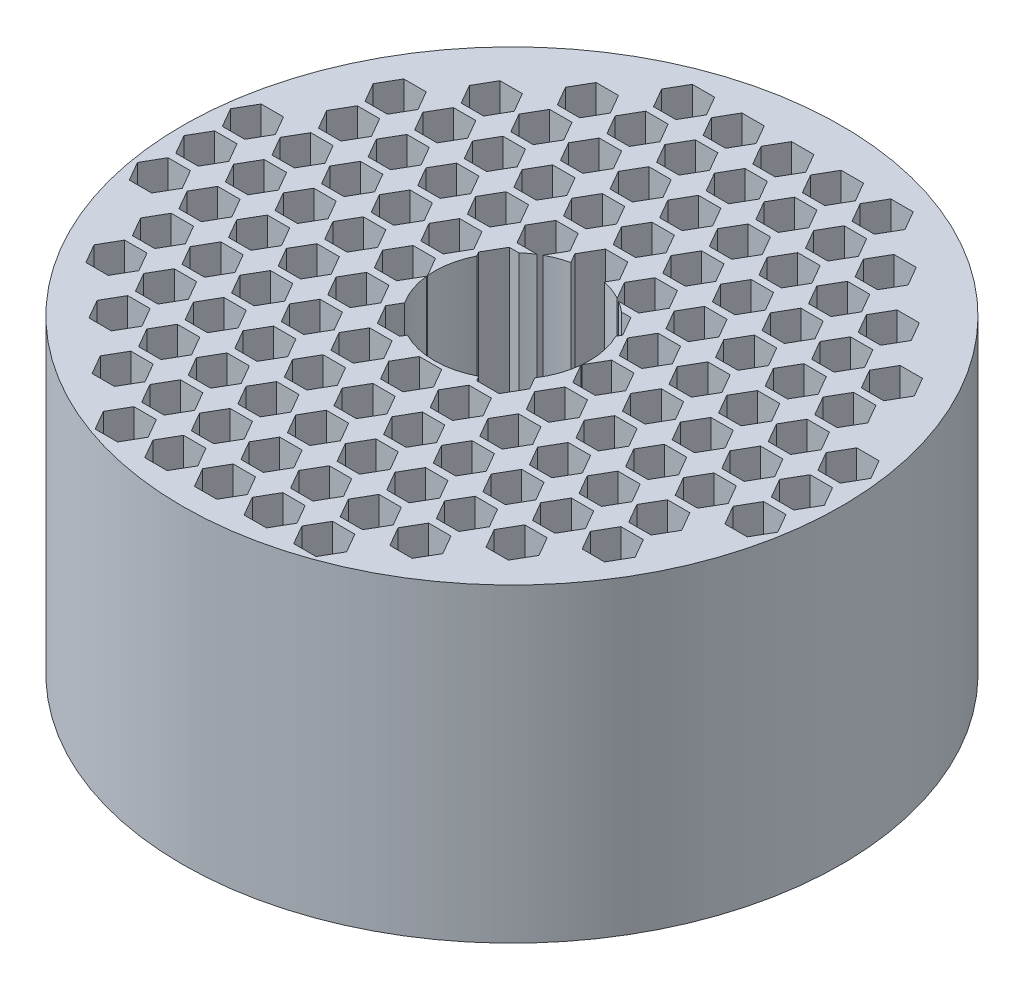
from build123d import *

# Parameters (mm, degrees)
SKETCH1_R            = 26.9875
BOSS_EXTRUDE1_DEPTH  = 25.4
CUT_EXTRUDE1_REACH   = 47.846
LPATTERN2_COUNT      = 13
LPATTERN2_PITCH      = 3.81
LPATTERN2_COUNT_DIR2 = 10
LPATTERN2_PITCH_DIR2 = 4.064
MIRROR1_DEPTH        = 25.4
CUT_EXTRUDE2_REACH   = 47.846
SKETCH5_R            = 6.35


# Read off the part's stored shape, not the designer's step: Mirror1
with BuildPart() as part:
    # Sketch1 → Boss-Extrude1 (new body)
    with BuildSketch(Plane(origin=(0, 0, 0), x_dir=(1, 0, 0), z_dir=(0, 1, 0))):
        with Locations(Location((0, 0, 0), (0, 0, 270))):
            Circle(SKETCH1_R)
    extrude(amount=BOSS_EXTRUDE1_DEPTH)

    # Sketch2 → Cut-Extrude1 (cut, up to next)
    with BuildSketch(Plane(origin=(0, 25.4, 0), x_dir=(1, 0, 0), z_dir=(0, 1, 0)), mode=Mode.PRIVATE) as cut_extrude1_sk1:
        Polygon((0.916543552, 20.6375), (1.833087105, 22.225), (0.916543552, 23.8125), (-0.916543552, 23.8125), (-1.833087105, 22.225), (-0.916543552, 20.6375), align=None)
    cut_extrude1_tool1 = extrude(cut_extrude1_sk1.sketch, amount=-CUT_EXTRUDE1_REACH, mode=Mode.PRIVATE) & part.part
    cut_extrude1 = cut_extrude1_tool1.solids().sort_by_distance((0, 25.4, -22.225))[0]
    add(cut_extrude1, mode=Mode.SUBTRACT)

    # LPattern2: Cut-Extrude1 13 × 10, 61 skipped
    with Locations(*[(-j * LPATTERN2_PITCH_DIR2, 0, i * LPATTERN2_PITCH) for i in range(LPATTERN2_COUNT) for j in range(LPATTERN2_COUNT_DIR2) if (i, j) not in ((0, 0), (0, 3), (0, 4), (0, 5), (0, 6), (0, 7), (0, 8), (0, 9), (1, 4), (1, 5), (1, 6), (1, 7), (1, 8), (1, 9), (2, 5), (2, 6), (2, 7), (2, 8), (2, 9), (3, 6), (3, 7), (3, 8), (3, 9), (4, 6), (4, 7), (4, 8), (4, 9), (5, 7), (5, 8), (5, 9), (6, 7), (6, 8), (6, 9), (7, 7), (7, 8), (7, 9), (8, 6), (8, 7), (8, 8), (8, 9), (9, 6), (9, 7), (9, 8), (9, 9), (10, 5), (10, 6), (10, 7), (10, 8), (10, 9), (11, 4), (11, 5), (11, 6), (11, 7), (11, 8), (11, 9), (12, 3), (12, 4), (12, 5), (12, 6), (12, 7), (12, 8), (12, 9))]):
        add(cut_extrude1, mode=Mode.SUBTRACT)

    # Mirror1 outline → Mirror1 (cut)
    with BuildSketch(Plane(origin=(0, 0, 0), x_dir=(1, 0, 0), z_dir=(0, 1, 0))):
        Polygon((3.147456448, 20.6375), (4.980543552, 20.6375), (5.897087105, 22.225), (4.980543552, 23.8125), (3.147456448, 23.8125), (2.230912895, 22.225), align=None)
        Polygon((7.211456448, 20.6375), (9.044543552, 20.6375), (9.961087105, 22.225), (9.044543552, 23.8125), (7.211456448, 23.8125), (6.294912895, 22.225), align=None)
        Polygon((3.147456448, 16.8275), (4.980543552, 16.8275), (5.897087105, 18.415), (4.980543552, 20.0025), (3.147456448, 20.0025), (2.230912895, 18.415), align=None)
        Polygon((7.211456448, 16.8275), (9.044543552, 16.8275), (9.961087105, 18.415), (9.044543552, 20.0025), (7.211456448, 20.0025), (6.294912895, 18.415), align=None)
        Polygon((11.275456448, 16.8275), (13.108543552, 16.8275), (14.025087105, 18.415), (13.108543552, 20.0025), (11.275456448, 20.0025), (10.358912895, 18.415), align=None)
        Polygon((3.147456448, 13.0175), (4.980543552, 13.0175), (5.897087105, 14.605), (4.980543552, 16.1925), (3.147456448, 16.1925), (2.230912895, 14.605), align=None)
        Polygon((7.211456448, 13.0175), (9.044543552, 13.0175), (9.961087105, 14.605), (9.044543552, 16.1925), (7.211456448, 16.1925), (6.294912895, 14.605), align=None)
        Polygon((11.275456448, 13.0175), (13.108543552, 13.0175), (14.025087105, 14.605), (13.108543552, 16.1925), (11.275456448, 16.1925), (10.358912895, 14.605), align=None)
        Polygon((15.339456448, 13.0175), (17.172543552, 13.0175), (18.089087105, 14.605), (17.172543552, 16.1925), (15.339456448, 16.1925), (14.422912895, 14.605), align=None)
        Polygon((3.147456448, 9.2075), (4.980543552, 9.2075), (5.897087105, 10.795), (4.980543552, 12.3825), (3.147456448, 12.3825), (2.230912895, 10.795), align=None)
        Polygon((7.211456448, 9.2075), (9.044543552, 9.2075), (9.961087105, 10.795), (9.044543552, 12.3825), (7.211456448, 12.3825), (6.294912895, 10.795), align=None)
        Polygon((11.275456448, 9.2075), (13.108543552, 9.2075), (14.025087105, 10.795), (13.108543552, 12.3825), (11.275456448, 12.3825), (10.358912895, 10.795), align=None)
        Polygon((15.339456448, 9.2075), (17.172543552, 9.2075), (18.089087105, 10.795), (17.172543552, 12.3825), (15.339456448, 12.3825), (14.422912895, 10.795), align=None)
        Polygon((19.403456448, 9.2075), (21.236543552, 9.2075), (22.153087105, 10.795), (21.236543552, 12.3825), (19.403456448, 12.3825), (18.486912895, 10.795), align=None)
        Polygon((3.147456448, 5.3975), (4.980543552, 5.3975), (5.897087105, 6.985), (4.980543552, 8.5725), (3.147456448, 8.5725), (2.230912895, 6.985), align=None)
        Polygon((7.211456448, 5.3975), (9.044543552, 5.3975), (9.961087105, 6.985), (9.044543552, 8.5725), (7.211456448, 8.5725), (6.294912895, 6.985), align=None)
        Polygon((11.275456448, 5.3975), (13.108543552, 5.3975), (14.025087105, 6.985), (13.108543552, 8.5725), (11.275456448, 8.5725), (10.358912895, 6.985), align=None)
        Polygon((15.339456448, 5.3975), (17.172543552, 5.3975), (18.089087105, 6.985), (17.172543552, 8.5725), (15.339456448, 8.5725), (14.422912895, 6.985), align=None)
        Polygon((19.403456448, 5.3975), (21.236543552, 5.3975), (22.153087105, 6.985), (21.236543552, 8.5725), (19.403456448, 8.5725), (18.486912895, 6.985), align=None)
        Polygon((3.147456448, 1.5875), (4.980543552, 1.5875), (5.897087105, 3.175), (4.980543552, 4.7625), (3.147456448, 4.7625), (2.230912895, 3.175), align=None)
        Polygon((7.211456448, 1.5875), (9.044543552, 1.5875), (9.961087105, 3.175), (9.044543552, 4.7625), (7.211456448, 4.7625), (6.294912895, 3.175), align=None)
        Polygon((11.275456448, 1.5875), (13.108543552, 1.5875), (14.025087105, 3.175), (13.108543552, 4.7625), (11.275456448, 4.7625), (10.358912895, 3.175), align=None)
        Polygon((15.339456448, 1.5875), (17.172543552, 1.5875), (18.089087105, 3.175), (17.172543552, 4.7625), (15.339456448, 4.7625), (14.422912895, 3.175), align=None)
        Polygon((19.403456448, 1.5875), (21.236543552, 1.5875), (22.153087105, 3.175), (21.236543552, 4.7625), (19.403456448, 4.7625), (18.486912895, 3.175), align=None)
        Polygon((23.467456448, 1.5875), (25.300543552, 1.5875), (26.217087105, 3.175), (25.300543552, 4.7625), (23.467456448, 4.7625), (22.550912895, 3.175), align=None)
        Polygon((3.147456448, -2.2225), (4.980543552, -2.2225), (5.897087105, -0.635), (4.980543552, 0.9525), (3.147456448, 0.9525), (2.230912895, -0.635), align=None)
        Polygon((7.211456448, -2.2225), (9.044543552, -2.2225), (9.961087105, -0.635), (9.044543552, 0.9525), (7.211456448, 0.9525), (6.294912895, -0.635), align=None)
        Polygon((11.275456448, -2.2225), (13.108543552, -2.2225), (14.025087105, -0.635), (13.108543552, 0.9525), (11.275456448, 0.9525), (10.358912895, -0.635), align=None)
        Polygon((15.339456448, -2.2225), (17.172543552, -2.2225), (18.089087105, -0.635), (17.172543552, 0.9525), (15.339456448, 0.9525), (14.422912895, -0.635), align=None)
        Polygon((19.403456448, -2.2225), (21.236543552, -2.2225), (22.153087105, -0.635), (21.236543552, 0.9525), (19.403456448, 0.9525), (18.486912895, -0.635), align=None)
        Polygon((23.467456448, -2.2225), (25.300543552, -2.2225), (26.217087105, -0.635), (25.300543552, 0.9525), (23.467456448, 0.9525), (22.550912895, -0.635), align=None)
        Polygon((3.147456448, -6.0325), (4.980543552, -6.0325), (5.897087105, -4.445), (4.980543552, -2.8575), (3.147456448, -2.8575), (2.230912895, -4.445), align=None)
        Polygon((7.211456448, -6.0325), (9.044543552, -6.0325), (9.961087105, -4.445), (9.044543552, -2.8575), (7.211456448, -2.8575), (6.294912895, -4.445), align=None)
        Polygon((11.275456448, -6.0325), (13.108543552, -6.0325), (14.025087105, -4.445), (13.108543552, -2.8575), (11.275456448, -2.8575), (10.358912895, -4.445), align=None)
        Polygon((15.339456448, -6.0325), (17.172543552, -6.0325), (18.089087105, -4.445), (17.172543552, -2.8575), (15.339456448, -2.8575), (14.422912895, -4.445), align=None)
        Polygon((19.403456448, -6.0325), (21.236543552, -6.0325), (22.153087105, -4.445), (21.236543552, -2.8575), (19.403456448, -2.8575), (18.486912895, -4.445), align=None)
        Polygon((23.467456448, -6.0325), (25.300543552, -6.0325), (26.217087105, -4.445), (25.300543552, -2.8575), (23.467456448, -2.8575), (22.550912895, -4.445), align=None)
        Polygon((3.147456448, -9.8425), (4.980543552, -9.8425), (5.897087105, -8.255), (4.980543552, -6.6675), (3.147456448, -6.6675), (2.230912895, -8.255), align=None)
        Polygon((7.211456448, -9.8425), (9.044543552, -9.8425), (9.961087105, -8.255), (9.044543552, -6.6675), (7.211456448, -6.6675), (6.294912895, -8.255), align=None)
        Polygon((11.275456448, -9.8425), (13.108543552, -9.8425), (14.025087105, -8.255), (13.108543552, -6.6675), (11.275456448, -6.6675), (10.358912895, -8.255), align=None)
        Polygon((15.339456448, -9.8425), (17.172543552, -9.8425), (18.089087105, -8.255), (17.172543552, -6.6675), (15.339456448, -6.6675), (14.422912895, -8.255), align=None)
        Polygon((19.403456448, -9.8425), (21.236543552, -9.8425), (22.153087105, -8.255), (21.236543552, -6.6675), (19.403456448, -6.6675), (18.486912895, -8.255), align=None)
        Polygon((3.147456448, -13.6525), (4.980543552, -13.6525), (5.897087105, -12.065), (4.980543552, -10.4775), (3.147456448, -10.4775), (2.230912895, -12.065), align=None)
        Polygon((7.211456448, -13.6525), (9.044543552, -13.6525), (9.961087105, -12.065), (9.044543552, -10.4775), (7.211456448, -10.4775), (6.294912895, -12.065), align=None)
        Polygon((11.275456448, -13.6525), (13.108543552, -13.6525), (14.025087105, -12.065), (13.108543552, -10.4775), (11.275456448, -10.4775), (10.358912895, -12.065), align=None)
        Polygon((15.339456448, -13.6525), (17.172543552, -13.6525), (18.089087105, -12.065), (17.172543552, -10.4775), (15.339456448, -10.4775), (14.422912895, -12.065), align=None)
        Polygon((19.403456448, -13.6525), (21.236543552, -13.6525), (22.153087105, -12.065), (21.236543552, -10.4775), (19.403456448, -10.4775), (18.486912895, -12.065), align=None)
        Polygon((3.147456448, -17.4625), (4.980543552, -17.4625), (5.897087105, -15.875), (4.980543552, -14.2875), (3.147456448, -14.2875), (2.230912895, -15.875), align=None)
        Polygon((7.211456448, -17.4625), (9.044543552, -17.4625), (9.961087105, -15.875), (9.044543552, -14.2875), (7.211456448, -14.2875), (6.294912895, -15.875), align=None)
        Polygon((11.275456448, -17.4625), (13.108543552, -17.4625), (14.025087105, -15.875), (13.108543552, -14.2875), (11.275456448, -14.2875), (10.358912895, -15.875), align=None)
        Polygon((15.339456448, -17.4625), (17.172543552, -17.4625), (18.089087105, -15.875), (17.172543552, -14.2875), (15.339456448, -14.2875), (14.422912895, -15.875), align=None)
        Polygon((3.147456448, -21.2725), (4.980543552, -21.2725), (5.897087105, -19.685), (4.980543552, -18.0975), (3.147456448, -18.0975), (2.230912895, -19.685), align=None)
        Polygon((7.211456448, -21.2725), (9.044543552, -21.2725), (9.961087105, -19.685), (9.044543552, -18.0975), (7.211456448, -18.0975), (6.294912895, -19.685), align=None)
        Polygon((11.275456448, -21.2725), (13.108543552, -21.2725), (14.025087105, -19.685), (13.108543552, -18.0975), (11.275456448, -18.0975), (10.358912895, -19.685), align=None)
        Polygon((3.147456448, -25.0825), (4.980543552, -25.0825), (5.897087105, -23.495), (4.980543552, -21.9075), (3.147456448, -21.9075), (2.230912895, -23.495), align=None)
        Polygon((7.211456448, -25.0825), (9.044543552, -25.0825), (9.961087105, -23.495), (9.044543552, -21.9075), (7.211456448, -21.9075), (6.294912895, -23.495), align=None)
    extrude(amount=MIRROR1_DEPTH, mode=Mode.SUBTRACT)

    # Sketch5 → Cut-Extrude2 (cut, up to next)
    with BuildSketch(Plane(origin=(0, 25.4, 0), x_dir=(1, 0, 0), z_dir=(0, 1, 0)), mode=Mode.PRIVATE) as cut_extrude2_sk1:
        Circle(SKETCH5_R)
    cut_extrude2_tool1 = extrude(cut_extrude2_sk1.sketch, amount=-CUT_EXTRUDE2_REACH, mode=Mode.PRIVATE) & part.part
    add(cut_extrude2_tool1.solids().sort_by_distance((0, 25.4, 0))[0], mode=Mode.SUBTRACT)


solid = part.part
